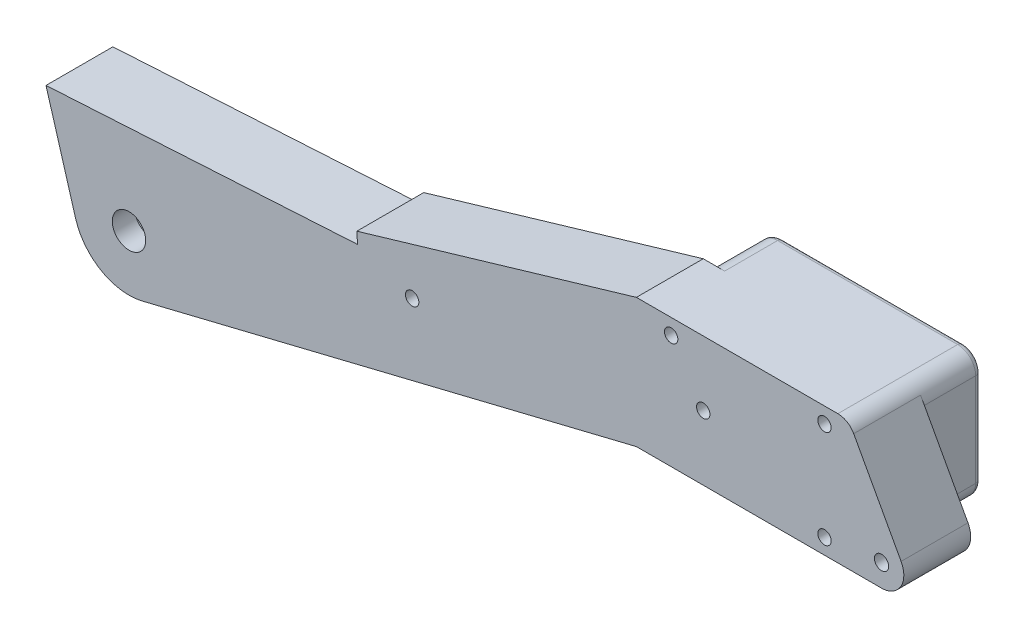
from build123d import *

# Parameters (mm, degrees)
BOSS_EXTRUDE1_DEPTH   = 19.05
SKETCH2_R             = 5.9944
CUT_EXTRUDE1_DEPTH    = 3.556
SKETCH3_R             = 4.7625
SKETCH3_R_2           = 1.905
CUT_EXTRUDE2_DEPTH    = 196.316614101
SKETCH4_R             = 2.032
CUT_EXTRUDE3_DEPTH    = 196.630821212
CUT_EXTRUDE4_DEPTH    = 12.7
BOSS_EXTRUDE2_START   = 16.66875
BOSS_EXTRUDE2_DEPTH   = 16.66875
CAVITY1_START         = -16.66875
CAVITY1_OUTLINE_R     = 1.143
CAVITY1_OUTLINE_R_2   = 4.445
CAVITY1_DEPTH         = 11.33475
CAVITY1_2_OUTLINE_R   = 1.143
CAVITY1_2_OUTLINE_R_2 = 4.445
CAVITY1_2_DEPTH       = 1.17475
CAVITY1_START_2       = -3.302
CAVITY1_3_OUTLINE_R   = 1.905
CAVITY1_3_DEPTH       = 22.352
CAVITY1_START_3       = -5.334
CAVITY1_4_OUTLINE_R   = 1.143
CAVITY1_4_OUTLINE_R_2 = 4.445
CAVITY1_4_DEPTH       = 3.048
CAVITY1_START_4       = -15.494
CAVITY1_5_DEPTH       = 1.778
CAVITY1_6_OUTLINE_R   = 2.286
CAVITY1_6_DEPTH       = 1.27
CAVITY1_START_5       = -2.286
CAVITY1_7_DEPTH       = 0.254
SKETCH10_R            = 1.905
CUT_EXTRUDE7_DEPTH    = 197.903629181
FILLET1_R             = 3.175
BOSS_EXTRUDE3_START   = -6.35
SKETCH12_R            = 1.905
BOSS_EXTRUDE3_DEPTH   = 6.35
BOSS_EXTRUDE4_DEPTH   = 28.194
FILLET2_R             = 1.5875


# Read off the part's stored shape, not the designer's step: Cavity1
with BuildPart() as part:
    # Sketch1 → Boss-Extrude1 (new body)
    with BuildSketch(Plane.XY):
        with BuildLine():
            Line((-159.825134937, -52.884497799), (-19.05, -18.415))
            Line((-19.05, -18.415), (50.8, -18.415))
            ThreePointArc((50.8, -18.415), (56.260378007, -15.306415126), (56.374599012, -9.024219533))
            Line((56.374599012, -9.024219533), (42.8694252, 15.734532178))
            ThreePointArc((42.8694252, 15.734532178), (40.979546252, 17.694406186), (38.354, 18.415))
            Line((38.354, 18.415), (-19.05, 18.415))
            Line((-19.05, 18.415), (-98.68529522, -5.075513517))
            Line((-98.68529522, -5.075513517), (-98.501389094, -8.245182827))
            Line((-98.501389094, -8.245182827), (-187.252129782, -13.394554368))
            Line((-187.252129782, -13.394554368), (-178.827060282, -41.956420263))
            ThreePointArc((-178.827060282, -41.956420263), (-171.514977839, -51.226520854), (-159.825134937, -52.884497799))
        make_face()
    extrude(amount=BOSS_EXTRUDE1_DEPTH)

    # Sketch2 → Cut-Extrude1 (cut)
    with BuildSketch(Plane.XY):
        with Locations((-163.600676305, -37.465)):
            Circle(SKETCH2_R)
    extrude(amount=CUT_EXTRUDE1_DEPTH, mode=Mode.SUBTRACT)

    # Sketch3 → Cut-Extrude2 (cut, through all)
    with BuildSketch(Plane(origin=(0, 0, 3.556), x_dir=(-1, 0, 0), z_dir=(0, 0, -1))):
        with Locations((163.600676305, -37.465)):
            Circle(SKETCH3_R)
        Circle(SKETCH3_R_2)
    extrude(amount=-CUT_EXTRUDE2_DEPTH, mode=Mode.SUBTRACT)

    # Sketch4 → Cut-Extrude3 (cut, through all)
    with BuildSketch(Plane.XY.offset(19.05)):
        with Locations((50.8, -12.065)):
            Circle(SKETCH4_R)
    extrude(amount=-CUT_EXTRUDE3_DEPTH, mode=Mode.SUBTRACT)

    # Sketch7 → Cut-Extrude4 (cut)
    with BuildSketch(Plane(origin=(0, 0, 0), x_dir=(-1, 0, 0), z_dir=(0, 0, -1))):
        with BuildLine():
            Line((-2.409706519, -10.522610869), (161.190969786, -47.987610869))
            ThreePointArc((161.190969786, -47.987610869), (174.253828499, -39.209240042), (164.672566331, -26.723348508))
            Line((164.672566331, -26.723348508), (87.759747737, -19.048357079))
            ThreePointArc((87.759747737, -19.048357079), (84.528976417, -6.817190634), (76.297376786, -16.423442945))
            Line((76.297376786, -16.423442945), (3.709521491, 10.13762671))
            ThreePointArc((3.709521491, 10.13762671), (-10.350542688, 3.065663233), (-2.409706519, -10.522610869))
        make_face()
    extrude(amount=-CUT_EXTRUDE4_DEPTH, mode=Mode.SUBTRACT)

    # Sketch11 → Boss-Extrude2 (add)
    with BuildSketch(Plane(origin=(0, 0, 0), x_dir=(-1, 0, 0), z_dir=(0, 0, -1)).offset(BOSS_EXTRUDE2_START)):
        with BuildLine():
            Line((-2.409706519, -10.522610869), (17.746699442, -15.138482675))
            ThreePointArc((17.746699442, -15.138482675), (15.856823355, -17.517581584), (12.954, -18.415))
            Line((12.954, -18.415), (-38.354, -18.415))
            ThreePointArc((-38.354, -18.415), (-41.991003729, -16.908503729), (-43.4975, -13.2715))
            Line((-43.4975, -13.2715), (-43.4975, 13.2715))
            ThreePointArc((-43.4975, 13.2715), (-41.991003729, 16.908503729), (-38.354, 18.415))
            Line((-38.354, 18.415), (12.954, 18.415))
            ThreePointArc((12.954, 18.415), (16.591003729, 16.908503729), (18.0975, 13.2715))
            Line((18.0975, 13.2715), (18.0975, 4.872832788))
            Line((18.0975, 4.872832788), (3.709521491, 10.13762671))
            ThreePointArc((3.709521491, 10.13762671), (-10.350542688, 3.065663233), (-2.409706519, -10.522610869))
        make_face()
    extrude(amount=-BOSS_EXTRUDE2_DEPTH)

    # Cavity1 outline → Cavity1 (cut)
    with BuildSketch(Plane.XY.offset(CAVITY1_START)):
        with Locations((34.544, 13.97)):
            Circle(CAVITY1_OUTLINE_R)
        with Locations((25.4, 0)):
            Circle(CAVITY1_OUTLINE_R_2)
        with BuildLine():
            ThreePointArc((-3.709521491, 10.13762671), (10.350542688, 3.065663233), (2.409706519, -10.522610869))
            Line((2.409706519, -10.522610869), (-6.807858195, -12.633458267))
            ThreePointArc((-6.807858195, -12.633458267), (2.139882746, -14.190563866), (10.230567504, -10.064128852))
            ThreePointArc((10.230567504, -10.064128852), (14.039105214, -10.236847552), (12.710188518, -6.663505747))
            ThreePointArc((12.710188518, -6.663505747), (14.351, 0), (12.710188518, 6.663505747))
            ThreePointArc((12.710188518, 6.663505747), (14.039105214, 10.236847552), (10.230567504, 10.064128852))
            ThreePointArc((10.230567504, 10.064128852), (0, 14.351), (-10.230567504, 10.064128852))
            ThreePointArc((-10.230567504, 10.064128852), (-13.9520423, 10.348782747), (-12.981772977, 6.744760003))
            Line((-12.981772977, 6.744760003), (-3.709521491, 10.13762671))
        make_face()
        with Locations((34.544, -13.97)):
            Circle(CAVITY1_OUTLINE_R)
        with BuildLine():
            ThreePointArc((-10.131608702, -13.394606177), (-8.888854604, -15.084158798), (-8.505216462, -13.022157929))
            Line((-8.505216462, -13.022157929), (-10.131608702, -13.394606177))
        make_face()
        with Locations((-9.144, 13.97)):
            Circle(CAVITY1_OUTLINE_R)
    extrude(amount=CAVITY1_DEPTH, mode=Mode.SUBTRACT)

    # Cavity1 2 outline → Cavity1 2 (cut)
    with BuildSketch(Plane.XY.offset(CAVITY1_START)):
        with BuildLine():
            Line((38.354, 16.8275), (-12.954, 16.8275))
            ThreePointArc((-12.954, 16.8275), (-15.468471714, 15.785971714), (-16.51, 13.2715))
            Line((-16.51, 13.2715), (-16.51, 5.4537247))
            Line((-16.51, 5.4537247), (-12.981772977, 6.744760003))
            ThreePointArc((-12.981772977, 6.744760003), (-13.9520423, 10.348782747), (-10.230567504, 10.064128852))
            ThreePointArc((-10.230567504, 10.064128852), (0, 14.351), (10.230567504, 10.064128852))
            ThreePointArc((10.230567504, 10.064128852), (14.039105214, 10.236847552), (12.710188518, 6.663505747))
            ThreePointArc((12.710188518, 6.663505747), (14.351, 0), (12.710188518, -6.663505747))
            ThreePointArc((12.710188518, -6.663505747), (14.039105214, -10.236847552), (10.230567504, -10.064128852))
            ThreePointArc((10.230567504, -10.064128852), (2.139882746, -14.190563866), (-6.807858195, -12.633458267))
            Line((-6.807858195, -12.633458267), (-8.505216462, -13.022157929))
            ThreePointArc((-8.505216462, -13.022157929), (-8.888854604, -15.084158798), (-10.131608702, -13.394606177))
            Line((-10.131608702, -13.394606177), (-16.174869251, -14.778529285))
            ThreePointArc((-16.174869251, -14.778529285), (-14.862682774, -16.271844325), (-12.954, -16.8275))
            Line((-12.954, -16.8275), (38.354, -16.8275))
            ThreePointArc((38.354, -16.8275), (40.868471714, -15.785971714), (41.91, -13.2715))
            Line((41.91, -13.2715), (41.91, 13.2715))
            ThreePointArc((41.91, 13.2715), (40.868471714, 15.785971714), (38.354, 16.8275))
        make_face()
        with Locations((34.544, 13.97)):
            Circle(CAVITY1_2_OUTLINE_R, mode=Mode.SUBTRACT)
        with Locations((25.4, 0)):
            Circle(CAVITY1_2_OUTLINE_R_2, mode=Mode.SUBTRACT)
        with Locations((-9.144, 13.97)):
            Circle(CAVITY1_2_OUTLINE_R, mode=Mode.SUBTRACT)
        with Locations((34.544, -13.97)):
            Circle(CAVITY1_2_OUTLINE_R, mode=Mode.SUBTRACT)
    extrude(amount=CAVITY1_2_DEPTH, mode=Mode.SUBTRACT)

    # Cavity1 3 outline → Cavity1 3 (cut)
    with BuildSketch(Plane.XY.offset(CAVITY1_START_2)):
        with Locations((34.544, 13.97)):
            Circle(CAVITY1_3_OUTLINE_R)
        with Locations((-9.144, 13.97)):
            Circle(CAVITY1_3_OUTLINE_R)
        with Locations((34.544, -13.97)):
            Circle(CAVITY1_3_OUTLINE_R)
        with Locations((-9.144, -13.97)):
            Circle(CAVITY1_3_OUTLINE_R)
    extrude(amount=CAVITY1_3_DEPTH, mode=Mode.SUBTRACT)

    # Cavity1 4 outline → Cavity1 4 (cut)
    with BuildSketch(Plane.XY.offset(CAVITY1_START_3)):
        with Locations((34.544, 13.97)):
            Circle(CAVITY1_4_OUTLINE_R)
        with Locations((25.4, 0)):
            Circle(CAVITY1_4_OUTLINE_R_2)
        with BuildLine():
            ThreePointArc((13.886815, 3.62043784), (12.050819068, 3.7542861), (10.366375, 3.011692939))
            ThreePointArc((10.366375, 3.011692939), (10.795, 0), (10.366375, -3.011692939))
            ThreePointArc((10.366375, -3.011692939), (12.050819068, -3.7542861), (13.886815, -3.62043784))
            ThreePointArc((13.886815, -3.62043784), (14.351, 0), (13.886815, 3.62043784))
        make_face()
        with Locations((34.544, -13.97)):
            Circle(CAVITY1_4_OUTLINE_R)
        with BuildLine():
            ThreePointArc((-10.131608702, -13.394606177), (-8.888854604, -15.084158798), (-8.505216462, -13.022157929))
            Line((-8.505216462, -13.022157929), (-10.131608702, -13.394606177))
        make_face()
        with Locations((-9.144, 13.97)):
            Circle(CAVITY1_4_OUTLINE_R)
    extrude(amount=CAVITY1_4_DEPTH, mode=Mode.SUBTRACT)

    # Cavity1 5 outline → Cavity1 5 (cut)
    with BuildSketch(Plane.XY.offset(CAVITY1_START_4)):
        with BuildLine():
            Line((24.389058667, 4.328512749), (26.298725966, 6.269761763))
            ThreePointArc((26.298725966, 6.269761763), (22.907666788, 4.581043617), (21.081648335, 1.261900966))
            Line((21.081648335, 1.261900966), (21.132941906, 1.245086431))
            ThreePointArc((21.132941906, 1.245086431), (22.343662494, 3.227510813), (24.389058667, 4.328512749))
        make_face()
        with BuildLine():
            ThreePointArc((33.067669635, 2.667234274), (30.288349771, 5.605544054), (26.298725966, 6.269761763))
            Line((26.298725966, 6.269761763), (24.389058667, 4.328512749))
            ThreePointArc((24.389058667, 4.328512749), (27.514880595, 3.909642575), (29.576068938, 1.522653349))
            Line((29.576068938, 1.522653349), (33.067669635, 2.667234274))
        make_face()
        with BuildLine():
            ThreePointArc((33.655, 0), (33.506429359, 1.365567248), (33.067669635, 2.667234274))
            Line((33.067669635, 2.667234274), (29.576068938, 1.522653349))
            ThreePointArc((29.576068938, 1.522653349), (29.777250931, 0.773110137), (29.845, 0))
            ThreePointArc((29.845, 0), (29.777250931, -0.773110137), (29.576068938, -1.522653349))
            Line((29.576068938, -1.522653349), (33.067669635, -2.667234274))
            ThreePointArc((33.067669635, -2.667234274), (33.506429359, -1.365567248), (33.655, 0))
        make_face()
        with BuildLine():
            Line((21.132941906, 1.245086431), (21.081648335, 1.261900966))
            ThreePointArc((21.081648335, 1.261900966), (21.048043509, 1.083049155), (21.019577582, 0.903307826))
            Line((21.019577582, 0.903307826), (21.055488936, 0.939813075))
            ThreePointArc((21.055488936, 0.939813075), (21.091510845, 1.093135949), (21.132941906, 1.245086431))
        make_face()
        with BuildLine():
            Line((21.055488936, 0.939813075), (21.019577582, 0.903307826))
            ThreePointArc((21.019577582, 0.903307826), (20.971164974, 0.452806658), (20.955, 1.03e-07))
            ThreePointArc((20.955, 1.03e-07), (20.980193636, 0.472585134), (21.055488936, 0.939813075))
        make_face()
        with BuildLine():
            ThreePointArc((26.298725967, -6.269761763), (30.288349771, -5.605544054), (33.067669635, -2.667234274))
            Line((33.067669635, -2.667234274), (29.576068938, -1.522653349))
            ThreePointArc((29.576068938, -1.522653349), (27.514880596, -3.909642575), (24.389058668, -4.32851275))
            Line((24.389058668, -4.32851275), (26.298725967, -6.269761763))
        make_face()
        with BuildLine():
            ThreePointArc((21.055488936, -0.939813075), (20.980193626, -0.472585032), (20.955, 1.03e-07))
            ThreePointArc((20.955, 1.03e-07), (20.971164967, -0.452806555), (21.019577582, -0.903307826))
            Line((21.019577582, -0.903307826), (21.055488936, -0.939813075))
        make_face()
        with BuildLine():
            ThreePointArc((21.081648335, -1.261900966), (22.907666788, -4.581043617), (26.298725967, -6.269761763))
            Line((26.298725967, -6.269761763), (24.389058668, -4.32851275))
            ThreePointArc((24.389058668, -4.32851275), (22.343662494, -3.227510813), (21.132941906, -1.245086431))
            Line((21.132941906, -1.245086431), (21.081648335, -1.261900966))
        make_face()
        with BuildLine():
            Line((21.055488936, -0.939813075), (21.019577582, -0.903307826))
            ThreePointArc((21.019577582, -0.903307826), (21.048043509, -1.083049155), (21.081648335, -1.261900966))
            Line((21.081648335, -1.261900966), (21.132941906, -1.245086431))
            ThreePointArc((21.132941906, -1.245086431), (21.091510845, -1.093135949), (21.055488936, -0.939813075))
        make_face()
    extrude(amount=CAVITY1_5_DEPTH, mode=Mode.SUBTRACT)

    # Cavity1 6 outline → Cavity1 6 (cut)
    with BuildSketch(Plane.XY.offset(CAVITY1_START_3)):
        with Locations((12.192, 8.89)):
            Circle(CAVITY1_6_OUTLINE_R)
        with BuildLine():
            Line((-12.981772977, 6.744760003), (-10.204176339, 7.761127513))
            ThreePointArc((-10.204176339, 7.761127513), (-12.977545727, 11.036791539), (-12.981772977, 6.744760003))
        make_face()
        with Locations((12.192, -8.89)):
            Circle(CAVITY1_6_OUTLINE_R)
    extrude(amount=CAVITY1_6_DEPTH, mode=Mode.SUBTRACT)

    # Cavity1 7 outline → Cavity1 7 (cut)
    with BuildSketch(Plane.XY.offset(CAVITY1_START_5)):
        with BuildLine():
            ThreePointArc((13.886815, 3.62043784), (12.050819068, 3.7542861), (10.366375, 3.011692939))
            ThreePointArc((10.366375, 3.011692939), (10.795, 0), (10.366375, -3.011692939))
            ThreePointArc((10.366375, -3.011692939), (12.050819068, -3.7542861), (13.886815, -3.62043784))
            ThreePointArc((13.886815, -3.62043784), (14.351, 0), (13.886815, 3.62043784))
        make_face()
    extrude(amount=CAVITY1_7_DEPTH, mode=Mode.SUBTRACT)

    # Sketch10 → Cut-Extrude7 (cut, through all)
    with BuildSketch(Plane(origin=(0, 0, 12.7), x_dir=(-1, 0, 0), z_dir=(0, 0, -1))):
        with Locations((82.934317691, -13.780683121)):
            Circle(SKETCH10_R)
    extrude(amount=-CUT_EXTRUDE7_DEPTH, mode=Mode.SUBTRACT)

    # Fillet1
    fillet1_edges = [part.edges().sort_by_distance(p)[0] for p in [
        (-76.297376786, -16.423442945, 6.35),
        (-87.759747737, -19.048357079, 6.35),
    ]]
    fillet(fillet1_edges, radius=FILLET1_R)

    # Sketch12 → Boss-Extrude3 (add)
    with BuildSketch(Plane.XY.offset(19.05).offset(BOSS_EXTRUDE3_START)):
        with Locations((-9.144, -13.97)):
            Circle(SKETCH12_R)
    extrude(amount=BOSS_EXTRUDE3_DEPTH)

    # Sketch13 → Boss-Extrude4 (add)
    with BuildSketch(Plane(origin=(0, 0, -15.494), x_dir=(-1, 0, 0), z_dir=(0, 0, -1))):
        with BuildLine():
            Line((7.624856541, -12.820553111), (11.011968624, -13.596210994))
            ThreePointArc((11.011968624, -13.596210994), (8.718757673, -15.82693133), (7.624856541, -12.820553111))
        make_face()
    extrude(amount=-BOSS_EXTRUDE4_DEPTH)

    # Fillet2
    # the kernel refuses this fillet: 1.5875 mm, written as the material it takes off along each edge
    with BuildSketch(Plane(origin=(-17.746699442, -15.138482675, -23.911150838), x_dir=(0.6106954034242549, -0.7918655973310663, 0), z_dir=(0, 0, 1))) as fillet2_piece_1:
        with BuildLine():
            CenterArc((2.449898555, 1.523250477), FILLET2_R, 155.258681488, 131.097858692)
            Line((1.008120579, 2.187654359), (0, 0))
            ThreePointArc((0, 0), (1.448480168, -0.208168456), (2.896960335, 0))
        make_face()
    extrude(amount=23.911150838, mode=Mode.SUBTRACT)
    with BuildSketch(Plane(origin=(-18.0975, 4.872832788, -22.347082939), x_dir=(0, 1, 0), z_dir=(0, 0, 1))) as fillet2_piece_2:
        with BuildLine():
            CenterArc((FILLET2_R * 1.43076105538, -FILLET2_R), FILLET2_R, 90, 110.098389725)
            Line((FILLET2_R * 0.491657145245, -FILLET2_R * 1.34363330159), (0, 0))
            Line((0, 0), (FILLET2_R * 1.43076105538, 0))
        make_face()
    extrude(amount=22.347082939, mode=Mode.SUBTRACT)
    with BuildSketch(Plane(origin=(-18.0975, 13.2715, -16.66875), x_dir=(1, 0, 0), z_dir=(0, -1, 0))) as fillet2_piece_3:
        with BuildLine():
            CenterArc((FILLET2_R, FILLET2_R), FILLET2_R, 180, 90)
            Line((0, FILLET2_R), (0, 0))
            Line((0, 0), (FILLET2_R, 0))
        make_face()
    extrude(amount=12.367417212, mode=Mode.SUBTRACT)
    with BuildSketch(Plane(origin=(-12.954, 13.2715, -16.66875), x_dir=(0, 1, 0), z_dir=(1, 0, 0))) as fillet2_piece_4:
        with BuildLine():
            CenterArc((5.1435 - FILLET2_R, FILLET2_R), FILLET2_R, 270, 90)
            Line((5.1435, FILLET2_R), (5.1435, 0))
            Line((5.1435, 0), (5.1435 - FILLET2_R, 0))
        make_face()
    revolve(axis=Axis((-12.954, 13.2715, -16.66875), (0, 0, 1)), revolution_arc=90, mode=Mode.SUBTRACT)
    with BuildSketch(Plane(origin=(-12.954, -13.2715, -16.66875), x_dir=(-0.920935313965131, 0.3897154699161245, 0), z_dir=(0.3897154699161245, 0.920935313965131, 0))) as fillet2_piece_5:
        with BuildLine():
            CenterArc((5.1435 - FILLET2_R, FILLET2_R), FILLET2_R, 270, 90)
            Line((5.1435, FILLET2_R), (5.1435, 0))
            Line((5.1435, 0), (5.1435 - FILLET2_R, 0))
        make_face()
    revolve(axis=Axis((-12.954, -13.2715, -16.66875), (0, 0, 1)), revolution_arc=112.93679627, mode=Mode.SUBTRACT)
    with BuildSketch(Plane(origin=(-12.954, -18.415, -16.66875), x_dir=(0, 1, 0), z_dir=(1, 0, 0)), Plane(origin=(38.354, 18.415, -16.66875), x_dir=(0, -1, 0), z_dir=(-1, 0, 0))) as fillet2_piece_6:
        with BuildLine():
            CenterArc((FILLET2_R, FILLET2_R), FILLET2_R, 180, 90)
            Line((0, FILLET2_R), (0, 0))
            Line((0, 0), (FILLET2_R, 0))
        make_face()
    extrude(amount=51.308, mode=Mode.SUBTRACT)
    with BuildSketch(Plane(origin=(38.354, -13.2715, -16.66875), x_dir=(0, -1, 0), z_dir=(-1, 0, 0))) as fillet2_piece_7:
        with BuildLine():
            CenterArc((5.1435 - FILLET2_R, FILLET2_R), FILLET2_R, 270, 90)
            Line((5.1435, FILLET2_R), (5.1435, 0))
            Line((5.1435, 0), (5.1435 - FILLET2_R, 0))
        make_face()
    revolve(axis=Axis((38.354, -13.2715, -16.66875), (0, 0, 1)), revolution_arc=90, mode=Mode.SUBTRACT)
    with BuildSketch(Plane(origin=(43.4975, -13.2715, -16.66875), x_dir=(-1, 0, 0), z_dir=(0, 1, 0))) as fillet2_piece_8:
        with BuildLine():
            CenterArc((FILLET2_R, FILLET2_R), FILLET2_R, 180, 90)
            Line((0, FILLET2_R), (0, 0))
            Line((0, 0), (FILLET2_R, 0))
        make_face()
    extrude(amount=26.543, mode=Mode.SUBTRACT)
    with BuildSketch(Plane(origin=(38.354, 13.2715, -16.66875), x_dir=(1, 0, 0), z_dir=(0, -1, 0))) as fillet2_piece_9:
        with BuildLine():
            CenterArc((5.1435 - FILLET2_R, FILLET2_R), FILLET2_R, 270, 90)
            Line((5.1435, FILLET2_R), (5.1435, 0))
            Line((5.1435, 0), (5.1435 - FILLET2_R, 0))
        make_face()
    revolve(axis=Axis((38.354, 13.2715, -16.66875), (0, 0, 1)), revolution_arc=90, mode=Mode.SUBTRACT)


solid = part.part
